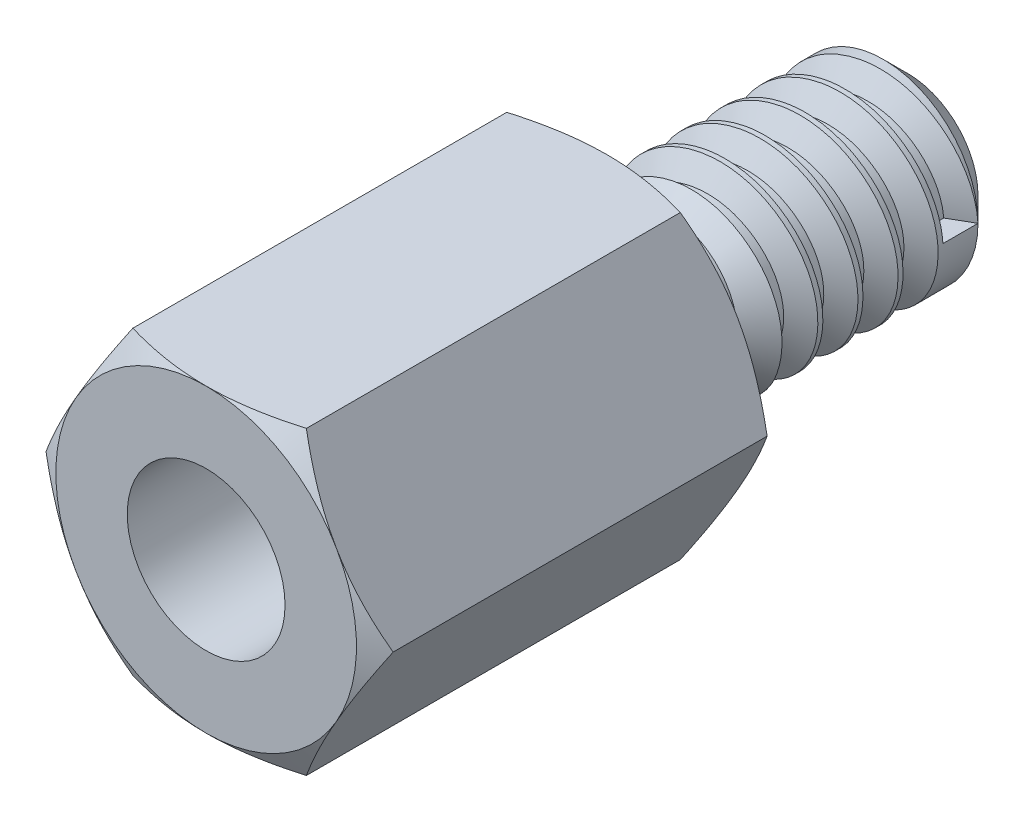
from build123d import *

# Parameters (mm, degrees)
EXTRUDE1_DEPTH       = 3.175
M3_TAPPED_HOLE_D     = 2.5
M3_TAPPED_HOLE_DEPTH = 5.9944
M3_TAPPED_HOLE_TIP   = 0.751075774
THREAD1_PITCH        = 0.635


with BuildPart() as part:
    # Sketch1 → Extrude1 (new, symmetric)
    with BuildSketch(Plane.XY):
        Polygon((2.749630657, 0), (1.374815329, 2.38125), (-1.374815329, 2.38125), (-2.749630657, 0), (-1.374815329, -2.38125), (1.374815329, -2.38125), align=None)
    extrude(amount=EXTRUDE1_DEPTH, both=True)

    # Sketch3 → Cut-Revolve1 (revolve, cut)
    with BuildSketch(Plane(origin=(0, 0, 0), x_dir=(0, 0, -1), z_dir=(1, 0, 0))):
        Polygon((-3.175, 2.38125), (-2.29511819, 3.90525), (-3.429, 3.90525), (-3.429, 2.38125), align=None)
    cut_revolve1 = revolve(axis=Axis((0, 0, 3.175), (0, 0, 1)), mode=Mode.SUBTRACT)

    # Mirror1: Cut-Revolve1 across plane
    add(cut_revolve1.mirror(Plane.XY), mode=Mode.SUBTRACT)

    # Sketch2 → M3 stud (revolve)
    with BuildSketch(Plane(origin=(0, 0, 0), x_dir=(0, 0, -1), z_dir=(1, 0, 0))):
        Polygon((3.175, 1.11506), (4.1275, 1.11506), (4.51244, 1.5), (7.55256, 1.5), (7.9375, 1.11506), (7.9375, 0), (3.175, 0), align=None)
    revolve(axis=Axis((0, 0, -3.175), (0, 0, 1)))

    # M3 Tapped Hole
    with Locations(Plane.XY.offset(3.175)):
        with Locations((0, 0)):
            Hole(M3_TAPPED_HOLE_D / 2, depth=M3_TAPPED_HOLE_DEPTH)
            with Locations((0, 0, -(M3_TAPPED_HOLE_DEPTH + M3_TAPPED_HOLE_TIP / 2))):  # 118° drill point
                Cone(0, M3_TAPPED_HOLE_D / 2, M3_TAPPED_HOLE_TIP, mode=Mode.SUBTRACT)

    # Thread1: the profile of Thread Profile1 profile screwed along a right-hand helix of 4.787591 turns, 6 arcs to a turn; built about Z, then put on its axis
    thread1_z = Axis((0, 0, 0), (0, 0, 1))
    thread1_corners = [(1.5003, 0, -0.000173205), (1.5003, 0, 0.555798203), (1.156296169, 0, 0.357187499), (1.156296169, 0, 0.198437499)]
    with BuildLine(mode=Mode.PRIVATE) as thread1_profile:
        Line(thread1_corners[0], thread1_corners[1])
        Line(thread1_corners[1], thread1_corners[2])
        Line(thread1_corners[2], thread1_corners[3])
        Line(thread1_corners[3], thread1_corners[0])
    thread1_cap = Face(thread1_profile.wire())
    thread1_turn_angles = [0, 30, 60, 90, 120, 150, 180, 210, 240, 270, 300, 330, 360]
    thread1_turn_weights = [1, 0.8660254037844387, 1, 0.8660254037844387, 1, 0.8660254037844387, 1, 0.8660254037844387, 1, 0.8660254037844387, 1, 0.8660254037844387, 1]
    thread1_turn_rails = [Edge.make_bspline([Vector(p[0], p[1], 0).rotate(thread1_z, thread1_turn_angles[k]) / thread1_turn_weights[k] + Vector(0, 0, p[2] + THREAD1_PITCH * thread1_turn_angles[k] / 360) for k in range(13)], [0, 0, 0, 1, 1, 2, 2, 3, 3, 4, 4, 5, 5, 6, 6, 6], 2, thread1_turn_weights) for p in thread1_corners]
    thread1_turn_sides = [Face.make_surface_from_curves(thread1_turn_rails[p[0]], thread1_turn_rails[p[1]]) for p in [(0, 1), (1, 2), (2, 3), (3, 0)]]
    thread1_last_angles = [1440, 1470, 1500, 1530, 1560, 1590, 1620, 1650, 1680, 1701.766299213, 1723.532598425]
    thread1_last_weights = [1, 0.8660254037844387, 1, 0.8660254037844387, 1, 0.8660254037844387, 1, 0.8660254037844387, 1, 0.9287041009915715, 1]
    thread1_last_rails = [Edge.make_bspline([Vector(p[0], p[1], 0).rotate(thread1_z, thread1_last_angles[k]) / thread1_last_weights[k] + Vector(0, 0, p[2] + THREAD1_PITCH * thread1_last_angles[k] / 360) for k in range(11)], [0, 0, 0, 1, 1, 2, 2, 3, 3, 4, 4, 5, 5, 5], 2, thread1_last_weights) for p in thread1_corners]
    thread1_last_sides = [Face.make_surface_from_curves(thread1_last_rails[p[0]], thread1_last_rails[p[1]]) for p in [(0, 1), (1, 2), (2, 3), (3, 0)]]
    thread1 = Plane(origin=(0, 0, -7.55256), x_dir=(1, 0, 0), z_dir=(0, 0, 1)) * Solid(Shell([*[p.moved(Location((0, 0, THREAD1_PITCH * i))) for i in range(4) for p in thread1_turn_sides], *thread1_last_sides, thread1_cap, thread1_cap.rotate(thread1_z, 1723.532598425).moved(Location((0, 0, THREAD1_PITCH * 1723.532598425 / 360)))]))
    add(thread1, mode=Mode.SUBTRACT)


solid = part.part
